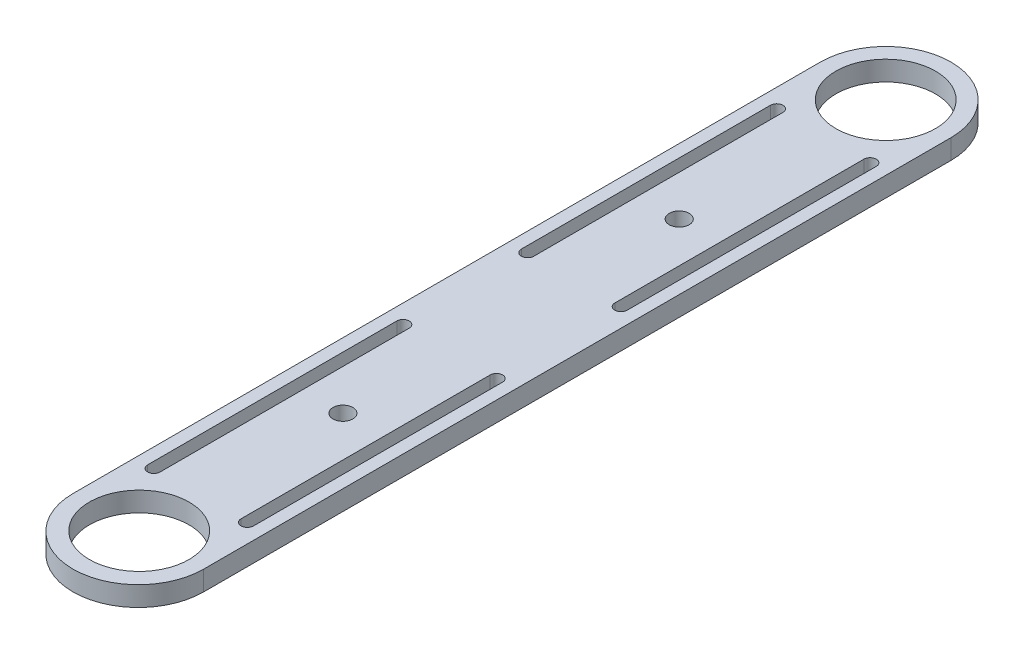
from build123d import *

# Parameters (mm, degrees)
BOSS_EXTRUDE1_DEPTH     = 3.175
CUT_EXTRUDE2_DEPTH      = 131.960225355
CUT_EXTRUDE2_DEPTH_BACK = 131.960225355
CUT_EXTRUDE3_DEPTH      = 131.960225355
CUT_EXTRUDE3_DEPTH_BACK = 131.960225355
SKETCH4_R               = 1.6
CUT_EXTRUDE4_DEPTH      = 131.960225355
CUT_EXTRUDE4_DEPTH_BACK = 131.960225355
SKETCH5_R               = 8


with BuildPart() as part:
    # Sketch1 → Boss-Extrude1 (new body)
    with BuildSketch(Plane(origin=(0, 0, 0), x_dir=(1, 0, 0), z_dir=(0, 1, 0))):
        with BuildLine():
            Line((-10.5, 0), (-10.5, -120))
            ThreePointArc((-10.5, -120), (0, -130.5), (10.5, -120))
            Line((10.5, -120), (10.5, 0))
            ThreePointArc((10.5, 0), (0, 10.5), (-10.5, 0))
        make_face()
    extrude(amount=BOSS_EXTRUDE1_DEPTH)

    # Sketch3 → Cut-Extrude2 (cut, two sides: drawn at the far end of the back side and taken through both)
    with BuildSketch(Plane.XZ.offset(-CUT_EXTRUDE2_DEPTH_BACK)):
        with BuildLine():
            Line((-8.5, 110), (-8.5, 70))
            ThreePointArc((-8.5, 70), (-7.5, 69), (-6.5, 70))
            Line((-6.5, 70), (-6.5, 110))
            ThreePointArc((-6.5, 110), (-7.5, 111), (-8.5, 110))
        make_face()
        with BuildLine():
            Line((6.5, 110), (6.5, 70))
            ThreePointArc((6.5, 70), (7.5, 69), (8.5, 70))
            Line((8.5, 70), (8.5, 110))
            ThreePointArc((8.5, 110), (7.5, 111), (6.5, 110))
        make_face()
        with BuildLine():
            Line((8.5, 10), (8.5, 50))
            ThreePointArc((8.5, 50), (7.5, 51), (6.5, 50))
            Line((6.5, 50), (6.5, 10))
            ThreePointArc((6.5, 10), (7.5, 9), (8.5, 10))
        make_face()
        with BuildLine():
            Line((-8.5, 50), (-8.5, 10))
            ThreePointArc((-8.5, 10), (-7.5, 9), (-6.5, 10))
            Line((-6.5, 10), (-6.5, 50))
            ThreePointArc((-6.5, 50), (-7.5, 51), (-8.5, 50))
        make_face()
    extrude(amount=CUT_EXTRUDE2_DEPTH + CUT_EXTRUDE2_DEPTH_BACK, mode=Mode.SUBTRACT)

    # Sketch4 → Cut-Extrude3 (cut, two sides: drawn at the far end of the back side and taken through both)
    with BuildSketch(Plane(origin=(0, 3.175, 0), x_dir=(1, 0, 0), z_dir=(0, 1, 0)).offset(-CUT_EXTRUDE3_DEPTH_BACK)):
        with Locations((0, -33.15)):
            Circle(SKETCH4_R)
        with Locations((0, -87.15)):
            Circle(SKETCH4_R)
    extrude(amount=CUT_EXTRUDE3_DEPTH + CUT_EXTRUDE3_DEPTH_BACK, mode=Mode.SUBTRACT)

    # Sketch5 → Cut-Extrude4 (cut, two sides: drawn at the far end of the back side and taken through both)
    with BuildSketch(Plane(origin=(0, 3.175, 0), x_dir=(1, 0, 0), z_dir=(0, 1, 0)).offset(-CUT_EXTRUDE4_DEPTH_BACK)):
        Circle(SKETCH5_R)
        with Locations((-0.007958643, -119.850211291)):
            Circle(SKETCH5_R)
    extrude(amount=CUT_EXTRUDE4_DEPTH + CUT_EXTRUDE4_DEPTH_BACK, mode=Mode.SUBTRACT)


solid = part.part
